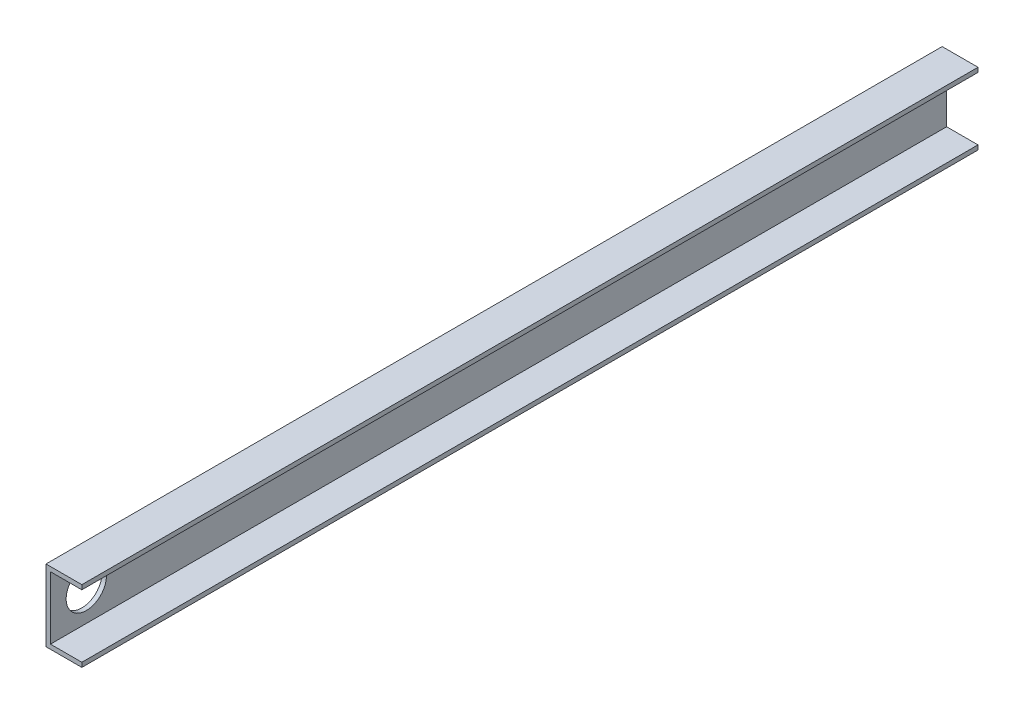
from build123d import *

# Parameters (mm, degrees)
BOSS_EXTRUDE1_DEPTH = 635
SKETCH2_R           = 14.2875
CUT_EXTRUDE1_DEPTH  = 638.534940219


with BuildPart() as part:
    # Sketch1 → Boss-Extrude1 (new body)
    with BuildSketch(Plane.XY):
        Polygon((0, 0), (0, 50.8), (25.4, 50.8), (25.4, 47.625), (3.175, 47.625), (3.175, 3.175), (25.4, 3.175), (25.4, 0), align=None)
    extrude(amount=BOSS_EXTRUDE1_DEPTH)

    # Sketch2 → Cut-Extrude1 (cut, through all)
    with BuildSketch(Plane.ZY):
        with Locations((609.6, 25.4)):
            Circle(SKETCH2_R)
    extrude(amount=-CUT_EXTRUDE1_DEPTH, mode=Mode.SUBTRACT)


solid = part.part
